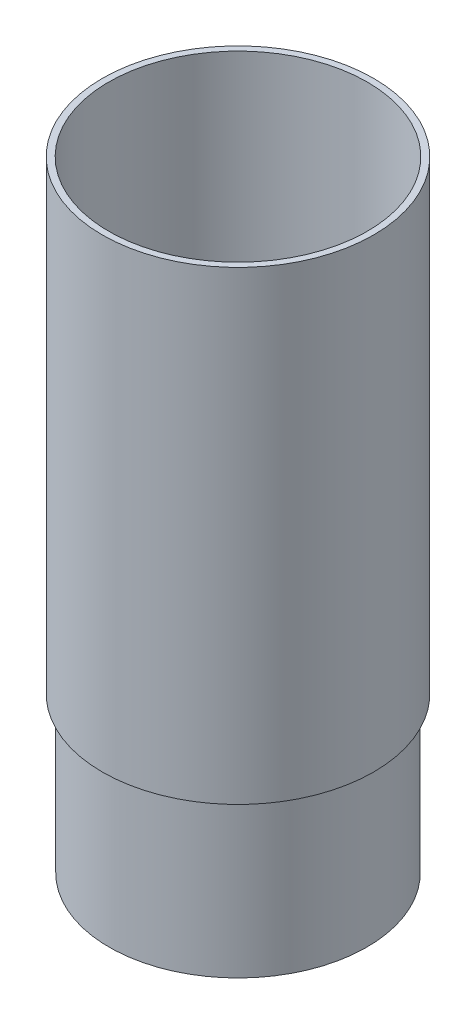
from build123d import *


with BuildPart() as part:
    # Sketch1 → Revolve1 (revolve)
    with BuildSketch(Plane.XY):
        Polygon((-20.0787, 0), (-20.0787, 27.3), (-21.1836, 31.423542937), (-21.1836, 101.6), (-22.225, 101.6), (-22.225, 25.4), (-21.1201, 25.4), (-21.1201, 0), align=None)
    revolve(axis=Axis((0, 0, 0), (0, 1, 0)))


solid = part.part
